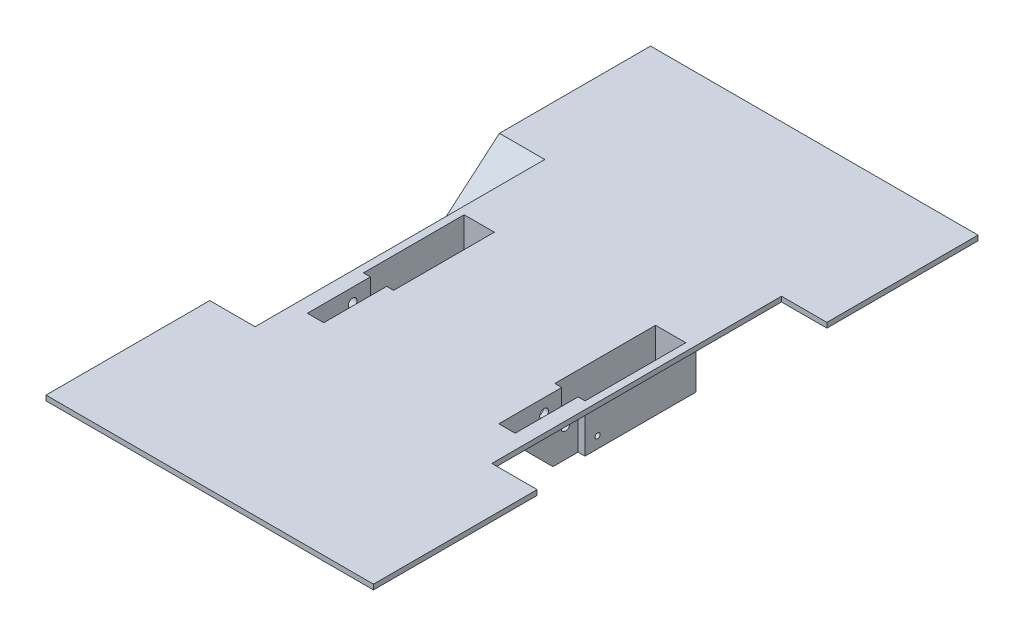
from build123d import *
from build123d.topology import SkipClean

# Parameters (mm, degrees)
SKETCH1_W                = 100
SKETCH1_H                = 100
BOSS_EXTRUDE1_DEPTH      = 2
CUT_EXTRUDE1_REACH       = 72.739
SKETCH2_W                = 12
SKETCH2_H                = 50
SKETCH3_W                = 2.75
SKETCH3_H                = 10
BOSS_EXTRUDE2_DEPTH      = 2
BOSS_EXTRUDE3_DEPTH      = 15
SKETCH5_R                = 1.75
SKETCH5_R_2              = 1
CUT_EXTRUDE2_DEPTH       = 103.318131336
CHAMFER1_SIZE            = 15
CHAMFER1_OF_MIRROR1_SIZE = 15
SKETCH6_W                = 130
SKETCH6_H                = 240
SKETCH6_W_2              = 100
SKETCH6_H_2              = 100
BOSS_EXTRUDE4_DEPTH      = 2
CUT_EXTRUDE3_REACH       = 139.295
SKETCH7_W                = 18
SKETCH7_H                = 115
BOSS_EXTRUDE5_DEPTH      = 18
SKETCH9_R                = 1.75
SKETCH9_R_2              = 1
BOSS_EXTRUDE10_DEPTH     = 1
BOSS_EXTRUDE11_START     = 2.75
SKETCH10_R               = 1.75
BOSS_EXTRUDE11_DEPTH     = 2.75


with BuildPart() as part:
    # Sketch1 → Boss-Extrude1 (new body)
    with BuildSketch(Plane(origin=(0, 0, 0), x_dir=(1, 0, 0), z_dir=(0, 1, 0))):
        Rectangle(SKETCH1_W, SKETCH1_H)
    extrude(amount=BOSS_EXTRUDE1_DEPTH)

    # Sketch2 → Cut-Extrude1 (cut, up to next)
    with BuildSketch(Plane(origin=(0, 2, 0), x_dir=(1, 0, 0), z_dir=(0, 1, 0)), mode=Mode.PRIVATE) as cut_extrude1_sk1:
        with Locations((38, 0)):
            Rectangle(SKETCH2_W, SKETCH2_H)
    cut_extrude1_tool1 = extrude(cut_extrude1_sk1.sketch, amount=-CUT_EXTRUDE1_REACH, mode=Mode.PRIVATE) & part.part
    cut_extrude1 = cut_extrude1_tool1.solids().sort_by_distance((38, 2, 0))[0]
    add(cut_extrude1, mode=Mode.SUBTRACT)

    # Sketch3 → Boss-Extrude2 (add)
    with BuildSketch(Plane.XZ):
        with Locations((33.375, 20)):
            Rectangle(SKETCH3_W, SKETCH3_H)
        with Locations((42.625, 20)):
            Rectangle(SKETCH3_W, SKETCH3_H)
    boss_extrude2 = extrude(amount=-BOSS_EXTRUDE2_DEPTH)

    # Sketch4 → Boss-Extrude3 (add)
    with BuildSketch(Plane.XZ):
        Polygon((46, 17), (43.25, 17), (43.25, 27), (32.75, 27), (32.75, 17), (30, 17), (30, -27), (46, -27), align=None)
        Polygon((44, 15), (41.25, 15), (41.25, 25), (34.75, 25), (34.75, 15), (32, 15), (32, -25), (44, -25), align=None, mode=Mode.SUBTRACT)
    boss_extrude3 = extrude(amount=BOSS_EXTRUDE3_DEPTH)

    # Sketch5 → Cut-Extrude2 (cut, symmetric)
    with BuildSketch(Plane.ZY.offset(-38)):
        with Locations(Location((22, -3.5, 0), (0, 0, 180))):
            Circle(SKETCH5_R)
        with Locations((12, -10.5)):
            Circle(SKETCH5_R_2)
    cut_extrude2 = extrude(amount=CUT_EXTRUDE2_DEPTH, both=True, mode=Mode.SUBTRACT)

    # Chamfer1
    chamfer1_edges = [part.edges().sort_by_distance(p)[0] for p in [
        (38, 2, 25),
        (38, 0, 27),
    ]]
    chamfer(chamfer1_edges, length=CHAMFER1_SIZE - 0.0001)  # a hair under: the kernel refuses the full size

    # Mirror1: Cut-Extrude1, Boss-Extrude2, Boss-Extrude3, Cut-Extrude2 across plane
    add(cut_extrude1.mirror(Plane(origin=(0, 0, 0), x_dir=(0, 0, 1), z_dir=(1, 0, 0))), mode=Mode.SUBTRACT)
    add(boss_extrude2.mirror(Plane(origin=(0, 0, 0), x_dir=(0, 0, 1), z_dir=(1, 0, 0))))
    add(boss_extrude3.mirror(Plane(origin=(0, 0, 0), x_dir=(0, 0, 1), z_dir=(1, 0, 0))))
    add(cut_extrude2.mirror(Plane(origin=(0, 0, 0), x_dir=(0, 0, 1), z_dir=(1, 0, 0))), mode=Mode.SUBTRACT)

    # Chamfer1 of Mirror1
    chamfer1_of_mirror1_edges = [part.edges().sort_by_distance(p)[0] for p in [
        (-38, 2, 25),
        (-38, 0, 27),
    ]]
    chamfer(chamfer1_of_mirror1_edges, length=CHAMFER1_OF_MIRROR1_SIZE - 0.0001)  # a hair under: the kernel refuses the full size

    # Sketch6 → Boss-Extrude4 (add)
    with BuildSketch(Plane.XZ):
        Rectangle(SKETCH6_W, SKETCH6_H)
        Rectangle(SKETCH6_W_2, SKETCH6_H_2, mode=Mode.SUBTRACT)
    extrude(amount=-BOSS_EXTRUDE4_DEPTH)

    # Sketch7 → Cut-Extrude3 (cut, up to next)
    with BuildSketch(Plane.XZ, mode=Mode.PRIVATE) as cut_extrude3_sk1:
        with Locations((-56, -2.5)):
            Rectangle(SKETCH7_W, SKETCH7_H)
    cut_extrude3_tool1 = extrude(cut_extrude3_sk1.sketch, amount=-CUT_EXTRUDE3_REACH, mode=Mode.PRIVATE) & part.part
    # Sketch7 → Cut-Extrude3 (cut, up to next)
    with BuildSketch(Plane.XZ, mode=Mode.PRIVATE) as cut_extrude3_sk2:
        with Locations((56, -2.5)):
            Rectangle(SKETCH7_W, SKETCH7_H)
    cut_extrude3_tool2 = extrude(cut_extrude3_sk2.sketch, amount=-CUT_EXTRUDE3_REACH, mode=Mode.PRIVATE) & part.part
    add(cut_extrude3_tool1.solids().sort_by_distance((-56, 0, -2.5))[0], mode=Mode.SUBTRACT)
    add(cut_extrude3_tool2.solids().sort_by_distance((56, 0, -2.5))[0], mode=Mode.SUBTRACT)

    # Sketch8 → Boss-Extrude5 (add)
    with BuildSketch(Plane.ZY.offset(65)):
        Polygon((55, 2), (34.200780206, -20), (-34.200780206, -20), (-60, 2), (-61.297715069, 0.478180168), (-34.937737308, -22), (35.062262692, -22), (56.453319038, 0.62600445), align=None)
    extrude(amount=-BOSS_EXTRUDE5_DEPTH)

    # Sketch9 → Boss-Extrude10 (add)
    with BuildSketch(Plane(origin=(-47, 0, 0), x_dir=(0, 0, -1), z_dir=(1, 0, 0))):
        Polygon((63.08234072, 2), (-57.75232065, 2), (-35.062262692, -22), (34.937737308, -22), align=None)
        with Locations((-22, -3.5)):
            Circle(SKETCH9_R, mode=Mode.SUBTRACT)
        with Locations(Location((-12, -10.5, 0), (0, 0, 180))):
            Circle(SKETCH9_R_2, mode=Mode.SUBTRACT)
    extrude(amount=BOSS_EXTRUDE10_DEPTH)

    # Sketch10 → Boss-Extrude11 (add)
    with SkipClean():  # the faces are left unmerged after this step: merging them gives an invalid solid
        with BuildSketch(Plane.ZY.offset(43.25).offset(BOSS_EXTRUDE11_START)):
            Polygon((42, 0), (17, 0), (17, -15), (27, -15), align=None)
            with Locations(Location((22, -3.5, 0), (0, 0, 180))):
                Circle(SKETCH10_R, mode=Mode.SUBTRACT)
        extrude(amount=-BOSS_EXTRUDE11_DEPTH)


solid = part.part
